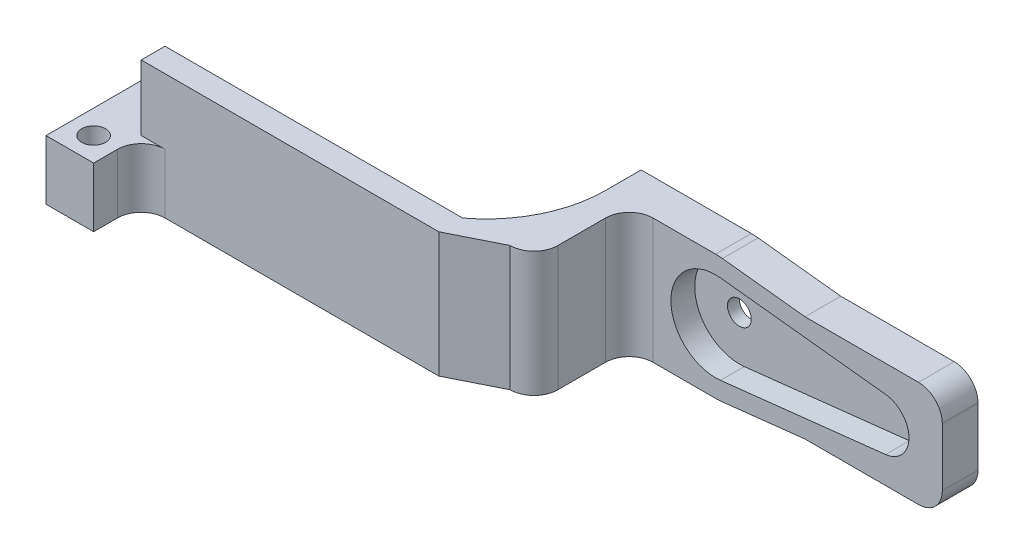
from build123d import *

# Parameters (mm, degrees)
BOSS_EXTRUDE1_DEPTH      = 2
BOSS_EXTRUDE2_DEPTH      = 1
SKETCH3_R                = 1
CUT_EXTRUDE1_DEPTH       = 1
BOSS_EXTRUDE3_DEPTH      = 2
BOSS_EXTRUDE3_DEPTH_BACK = 1
BOSS_EXTRUDE4_START      = -3
BOSS_EXTRUDE4_OUTLINE_R  = 1
BOSS_EXTRUDE4_DEPTH      = 3
SKETCH6_R                = 3.500627768
BOSS_EXTRUDE5_DEPTH      = 3
BOSS_EXTRUDE6_DEPTH      = 3
CUT_EXTRUDE2_DEPTH       = 15
FILLET1_R                = 20
FILLET2_R                = 3
FILLET3_R                = 3
SKETCH9_R                = 1
CUT_EXTRUDE3_DEPTH       = 15
CUT_EXTRUDE4_DEPTH       = 1.5
FILLET4_R                = 8
FILLET5_R                = 2
SKETCH11_W               = 110.258684369
SKETCH11_H               = 6.064888907
CUT_EXTRUDE5_DEPTH       = 38
SKETCH12_R               = 18.613151801
CUT_EXTRUDE6_DEPTH       = 29
SKETCH13_W               = 77.706478895
SKETCH13_H               = 41.021519778
CUT_EXTRUDE7_DEPTH       = 1
FILLET6_START            = -4.447684996
FILLET6_DEPTH            = 2
FILLET6_START_2          = 2.447684996
FILLET6_2_DEPTH          = 2
FILLET6_START_3          = -1
FILLET6_3_DEPTH          = 1
FILLET6_START_4          = -2.447684996
FILLET6_4_DEPTH          = 4.895369992
CUT_EXTRUDE8_DEPTH       = 37
CUT_EXTRUDE8_DEPTH_BACK  = 10
SKETCH14_W               = 81.474605317
SKETCH14_H               = 77.503756956
BOSS_EXTRUDE7_DEPTH      = 2
BOSS_EXTRUDE7_DEPTH_BACK = 1
BOSS_EXTRUDE8_DEPTH      = 8
BOSS_EXTRUDE8_DEPTH_BACK = 3
SKETCH16_W               = 2
SKETCH16_H               = 10.5
BOSS_EXTRUDE9_DEPTH      = 10.5
FILLET7_R                = 10
SKETCH18_W               = 1.521986252
SKETCH18_H               = 3
BOSS_EXTRUDE10_DEPTH     = 10.5
FILLET8_R                = 2
SKETCH19_W               = 25
SKETCH19_H               = 2
BOSS_EXTRUDE11_DEPTH     = 10.5
SKETCH20_W               = 4
SKETCH20_H               = 10
SKETCH20_R               = 1
BOSS_EXTRUDE12_DEPTH     = 5
FILLET9_R                = 2
FILLET10_R               = 2
FILLET11_R               = 2


with BuildPart() as part:
    # Sketch1 → Boss-Extrude1 (new body)
    with BuildSketch(Plane.XY):
        with BuildLine():
            Line((14.458185053, 3.677415528), (0.579181495, 5.217954465))
            ThreePointArc((0.579181495, 5.217954465), (-5.25, 0), (0.579181495, -5.217954465))
            Line((0.579181495, -5.217954465), (14.458185053, -3.677415528))
            ThreePointArc((14.458185053, -3.677415528), (17.75, 0), (14.458185053, 3.677415528))
        make_face()
        with BuildLine():
            Line((14.292704626, 2.186571395), (0.413701068, 3.727110332))
            ThreePointArc((0.413701068, 3.727110332), (-3.75, 0), (0.413701068, -3.727110332))
            Line((0.413701068, -3.727110332), (14.292704626, -2.186571395))
            ThreePointArc((14.292704626, -2.186571395), (16.25, 0), (14.292704626, 2.186571395))
        make_face(mode=Mode.SUBTRACT)
    extrude(amount=BOSS_EXTRUDE1_DEPTH)

    # Sketch2 → Boss-Extrude2 (add)
    with BuildSketch(Plane.XY.offset(2)):
        with BuildLine():
            Line((14.458185053, 3.677415528), (0.579181495, 5.217954465))
            ThreePointArc((0.579181495, 5.217954465), (-5.25, 0), (0.579181495, -5.217954465))
            Line((0.579181495, -5.217954465), (14.458185053, -3.677415528))
            ThreePointArc((14.458185053, -3.677415528), (17.75, 0), (14.458185053, 3.677415528))
        make_face()
    extrude(amount=BOSS_EXTRUDE2_DEPTH)

    # Sketch3 → Cut-Extrude1 (cut)
    with BuildSketch(Plane.XY.offset(3)):
        Circle(SKETCH3_R)
    extrude(amount=-CUT_EXTRUDE1_DEPTH, mode=Mode.SUBTRACT)

    # Sketch4 → Boss-Extrude3 (add, two sides: drawn at the far end of the back side and taken through both)
    with BuildSketch(Plane(origin=(0, 0, 2), x_dir=(-1, 0, 0), z_dir=(0, 0, -1)).offset(-BOSS_EXTRUDE3_DEPTH_BACK)):
        with BuildLine():
            Line((-15.26072202, 2.426182253), (-7.518683274, 4.447684996))
            Line((-7.518683274, 4.447684996), (-42.518683274, 4.447684996))
            ThreePointArc((-42.518683274, 4.447684996), (-39.373695053, 3.144988221), (-38.070998278, 0))
            ThreePointArc((-38.070998278, 0), (-39.373695053, -3.144988221), (-42.518683274, -4.447684996))
            Line((-42.518683274, -4.447684996), (-7.518683274, -4.447684996))
            Line((-7.518683274, -4.447684996), (-13.862339481, -2.595687971))
            Line((-13.862339481, -2.595687971), (-16.213670101, -1.84565397))
            Line((-16.213670101, -1.84565397), (-17.166618181, 0))
            Line((-17.166618181, 0), (-15.26072202, 2.426182253))
        make_face()
        with BuildLine():
            ThreePointArc((-38.070998278, 0), (-39.373695053, 3.144988221), (-42.518683274, 4.447684996))
            Line((-42.518683274, 4.447684996), (-42.518683274, 2))
            ThreePointArc((-42.518683274, 2), (-41.104469712, 1.414213562), (-40.518683274, 0))
            ThreePointArc((-40.518683274, 0), (-41.104469712, -1.414213562), (-42.518683274, -2))
            Line((-42.518683274, -2), (-42.518683274, -4.447684996))
            ThreePointArc((-42.518683274, -4.447684996), (-39.373695053, -3.144988221), (-38.070998278, 0))
        make_face()
        with BuildLine():
            Line((-42.518683274, 2), (-42.518683274, 4.447684996))
            ThreePointArc((-42.518683274, 4.447684996), (-46.96636827, 0), (-42.518683274, -4.447684996))
            Line((-42.518683274, -4.447684996), (-42.518683274, -2))
            ThreePointArc((-42.518683274, -2), (-44.518683274, 0), (-42.518683274, 2))
        make_face()
    extrude(amount=BOSS_EXTRUDE3_DEPTH + BOSS_EXTRUDE3_DEPTH_BACK)

    # Boss-Extrude4: read off the stored shape, not the designer's step
    # Boss-Extrude4 outline → Boss-Extrude4 (add)
    with BuildSketch(Plane(origin=(0, 0, 0), x_dir=(-1, 0, 0), z_dir=(0, 0, -1)).offset(BOSS_EXTRUDE4_START)):
        with BuildLine():
            ThreePointArc((-42.518683274, -4.447684996), (-46.96636827, 0), (-42.518683274, 4.447684996))
            Line((-42.518683274, 4.447684996), (-54.290526798, 4.447684996))
            ThreePointArc((-54.290526798, 4.447684996), (-59.289068337, 5.305033813), (-63.716210719, 7.779073998))
            ThreePointArc((-63.716210719, 7.779073998), (-80, 0), (-63.716210719, -7.779073998))
            ThreePointArc((-63.716210719, -7.779073998), (-59.289068337, -5.305033813), (-54.290526798, -4.447684996))
            Line((-54.290526798, -4.447684996), (-42.518683274, -4.447684996))
        make_face()
        with Locations((-68.205771366, -4.5)):
            Circle(BOSS_EXTRUDE4_OUTLINE_R, mode=Mode.SUBTRACT)
        with Locations((-76, 0)):
            Circle(BOSS_EXTRUDE4_OUTLINE_R, mode=Mode.SUBTRACT)
        with Locations((-68.205771366, 4.5)):
            Circle(BOSS_EXTRUDE4_OUTLINE_R, mode=Mode.SUBTRACT)
    extrude(amount=BOSS_EXTRUDE4_DEPTH)

    # Sketch6 → Boss-Extrude5 (add)
    with BuildSketch(Plane(origin=(0, 0, 0), x_dir=(-1, 0, 0), z_dir=(0, 0, -1))):
        with Locations((-42.518683274, 0)):
            Circle(SKETCH6_R)
    extrude(amount=-BOSS_EXTRUDE5_DEPTH)

    # Sketch7 → Boss-Extrude6 (add)
    with BuildSketch(Plane(origin=(0, 0, 0), x_dir=(-1, 0, 0), z_dir=(0, 0, -1))):
        Polygon((-54.290526798, 4.447684996), (-94.290526798, 4.447684996), (-94.290526798, -3.552315004), (-68.73970048, -3.552315004), (-92.931542949, -17.519481766), (-88.931542949, -24.447684996), (-54.290526798, -4.447684996), align=None)
    extrude(amount=-BOSS_EXTRUDE6_DEPTH)

    # Sketch8 → Cut-Extrude2 (cut)
    with BuildSketch(Plane(origin=(0, 0, 0), x_dir=(-1, 0, 0), z_dir=(0, 0, -1))):
        Polygon((-94.290526798, 4.447684996), (-45.837456427, 4.447684996), (-68.326886593, 15.265325323), align=None)
        Polygon((-94.290526798, -3.552315004), (-68.73970048, -3.552315004), (-92.931542949, -17.519481766), align=None)
    extrude(amount=-CUT_EXTRUDE2_DEPTH, mode=Mode.SUBTRACT)

    # Fillet1
    fillet1_edges = [part.edges().sort_by_distance(p)[0] for p in [
        (54.290526798, -4.447684996, 1.5),
    ]]
    fillet(fillet1_edges, radius=FILLET1_R)

    # Fillet2
    fillet2_edges = [part.edges().sort_by_distance(p)[0] for p in [
        (94.290526798, 4.447684996, 1.5),
        (94.290526798, -3.552315004, 1.5),
        (92.931542949, -17.519481766, 1.5),
        (88.931542949, -24.447684996, 1.5),
    ]]
    fillet(fillet2_edges, radius=FILLET2_R)

    # Fillet3
    fillet3_edges = [part.edges().sort_by_distance(p)[0] for p in [
        (68.73970048, -3.552315004, 1.5),
    ]]
    fillet(fillet3_edges, radius=FILLET3_R)

    # Sketch9 → Cut-Extrude3 (cut)
    with BuildSketch(Plane(origin=(0, 0, 0), x_dir=(-1, 0, 0), z_dir=(0, 0, -1))):
        with Locations((-89.290526798, 0.447684996)):
            Circle(SKETCH9_R)
        with Locations((-79.290526798, 0.447684996)):
            Circle(SKETCH9_R)
        with Locations((-77.941161892, -13.483583381)):
            Circle(SKETCH9_R)
        with Locations((-86.60141593, -18.483583381)):
            Circle(SKETCH9_R)
    extrude(amount=-CUT_EXTRUDE3_DEPTH, mode=Mode.SUBTRACT)

    # Sketch10 → Cut-Extrude4 (cut)
    with BuildSketch(Plane(origin=(0, 0, 0), x_dir=(-1, 0, 0), z_dir=(0, 0, -1))):
        with BuildLine():
            Line((-19.05, 2.447684996), (-67.154630008, 2.447684996))
            ThreePointArc((-67.154630008, 2.447684996), (-70.616179326, -5.909234314), (-62.259260015, -2.447684996))
            Line((-62.259260015, -2.447684996), (-19.05, -2.447684996))
            Line((-19.05, -2.447684996), (-19.05, 2.447684996))
        make_face()
    extrude(amount=-CUT_EXTRUDE4_DEPTH, mode=Mode.SUBTRACT)

    # Fillet4
    fillet4_edges = [part.edges().sort_by_distance(p)[0] for p in [
        (62.259260015, -2.447684996, 0.75),
    ]]
    fillet(fillet4_edges, radius=FILLET4_R)

    # Fillet5
    fillet5_edges = [part.edges().sort_by_distance(p)[0] for p in [
        (19.05, 2.447684996, 0.75),
        (19.05, -2.447684996, 0.75),
    ]]
    fillet(fillet5_edges, radius=FILLET5_R)

    # Mirror1: part across plane


with BuildPart() as part_1:
    add(part.part)
    add(part.part.mirror(Plane(origin=(14.05, 0, 0), x_dir=(1, 0, 0), z_dir=(0, 0, 1))))

    # Sketch11 → Cut-Extrude5 (cut)
    with BuildSketch(Plane(origin=(0, 4.447684996, 0), x_dir=(1, 0, 0), z_dir=(0, 1, 0))):
        with Locations((47.771534573, -3.032444454)):
            Rectangle(SKETCH11_W, SKETCH11_H)
    extrude(amount=-CUT_EXTRUDE5_DEPTH, mode=Mode.SUBTRACT)

    # Sketch12 → Cut-Extrude6 (cut)
    with BuildSketch(Plane.XY):
        with Locations((7.534351793, 3.599902348)):
            Circle(SKETCH12_R)
    extrude(amount=CUT_EXTRUDE6_DEPTH, mode=Mode.SUBTRACT)

    # Sketch13 → Cut-Extrude7 (cut)
    with BuildSketch(Plane.XY):
        with Locations((57.903239447, -8.718962854)):
            Rectangle(SKETCH13_W, SKETCH13_H)
    extrude(amount=-CUT_EXTRUDE7_DEPTH, mode=Mode.SUBTRACT)

    # Fillet6: read off the stored shape, not the designer's step
    # Fillet6 outline → Fillet6 (add)
    with BuildSketch(Plane(origin=(0, 0, 0), x_dir=(1, 0, 0), z_dir=(0, 1, 0)).offset(FILLET6_START)):
        with BuildLine():
            Line((19.05, 1), (19.049997006, -1.45e-06))
            ThreePointArc((19.049997006, -1.45e-06), (21.172829345, 0.746793973), (23.408898944, 1))
            Line((23.408898944, 1), (19.05, 1))
        make_face()
    extrude(amount=FILLET6_DEPTH)

    # Fillet6 2 outline → Fillet6 2 (add)
    with BuildSketch(Plane(origin=(0, 0, 0), x_dir=(1, 0, 0), z_dir=(0, 1, 0)).offset(FILLET6_START_2)):
        with BuildLine():
            Line((19.05, 1), (19.049997006, -1.45e-06))
            ThreePointArc((19.049997006, -1.45e-06), (21.172829345, 0.746793973), (23.408898944, 1))
            Line((23.408898944, 1), (19.05, 1))
        make_face()
    extrude(amount=FILLET6_2_DEPTH)

    # Fillet6 3 outline → Fillet6 3 (add)
    with BuildSketch(Plane.XY.offset(FILLET6_START_3)):
        with BuildLine():
            Line((19.05, 2.447684996), (19.05, 0.447684996))
            ThreePointArc((19.05, 0.447684996), (19.635786438, 1.861898559), (21.05, 2.447684996))
            Line((21.05, 2.447684996), (19.05, 2.447684996))
        make_face()
        with BuildLine():
            ThreePointArc((21.05, -2.447684996), (19.635786438, -1.861898559), (19.05, -0.447684996))
            Line((19.05, -0.447684996), (19.05, -2.447684996))
            Line((19.05, -2.447684996), (21.05, -2.447684996))
        make_face()
    extrude(amount=FILLET6_3_DEPTH)

    # Fillet6 4 outline → Fillet6 4 (cut)
    with BuildSketch(Plane(origin=(0, 0, 0), x_dir=(1, 0, 0), z_dir=(0, 1, 0)).offset(FILLET6_START_4)):
        with BuildLine():
            ThreePointArc((23, 0.991636585), (20.973982557, 0.699029961), (19.049997006, -1.45e-06))
            Line((19.049997006, -1.45e-06), (18, -0.508538641))
            Line((18, -0.508538641), (18, -1))
            Line((18, -1), (23, -1))
            Line((23, -1), (23, 0.991636585))
        make_face()
    extrude(amount=FILLET6_4_DEPTH, mode=Mode.SUBTRACT)

    # Sketch14 → Cut-Extrude8 (cut, two sides: drawn at the far end of the back side and taken through both)
    with BuildSketch(Plane.XY.offset(-2).offset(-CUT_EXTRUDE8_DEPTH_BACK)):
        with Locations((59.787302659, 4.447684996)):
            Rectangle(SKETCH14_W, SKETCH14_H)
    extrude(amount=CUT_EXTRUDE8_DEPTH + CUT_EXTRUDE8_DEPTH_BACK, mode=Mode.SUBTRACT)

    # Sketch15 → Boss-Extrude7 (add, two sides: drawn at the far end of the back side and taken through both)
    with BuildSketch(Plane.XY.offset(-2).offset(-BOSS_EXTRUDE7_DEPTH_BACK)):
        Polygon((0, 4.349044766), (-3.638836396, 3.035019198), (-4.3304288, -1.298959868), (-2.356179656, -4.022923876), (0, -4.398909991), (0, -5.25), (-7.25, -5.25), (-7.25, 5.25), (0, 5.25), align=None)
    extrude(amount=BOSS_EXTRUDE7_DEPTH + BOSS_EXTRUDE7_DEPTH_BACK)



with BuildPart() as body_2:
    # Sketch16 → Boss-Extrude8 (new, two sides: drawn at the far end of the back side and taken through both)
    with BuildSketch(Plane.XY.offset(-BOSS_EXTRUDE8_DEPTH_BACK)):
        with Locations((-8.25, 0)):
            Rectangle(SKETCH16_W, SKETCH16_H)
    extrude(amount=BOSS_EXTRUDE8_DEPTH + BOSS_EXTRUDE8_DEPTH_BACK)

    # Sketch17 → Boss-Extrude9 (add)
    with BuildSketch(Plane.XZ.offset(5.25)):
        Polygon((-9.25, 8), (-13.25, 10), (-13.25, 8), (-9.25, 6), align=None)
    extrude(amount=-BOSS_EXTRUDE9_DEPTH)

    # Fillet7
    # the kernel refuses this fillet: 10 mm, written as the material it adds along each edge
    with BuildSketch(Plane(origin=(-9.25, -5.25, 6), x_dir=(0, 0, -1), z_dir=(0, 1, 0))) as fillet7_piece_1:
        with BuildLine():
            CenterArc((6, 10), FILLET7_R, 216.869897646, 53.130102354)
            Line((-2, 4), (-2.16, 3.88))
            ThreePointArc((-2.16, 3.88), (-1.178885438, 1.910557281), (-0.178885438, -0.089442719))
            Line((-0.178885438, -0.089442719), (0, -0.2))
            Line((0, -0.2), (6, -0.2))
            Line((6, -0.2), (6, 0))
        make_face()
    extrude(amount=10.5)


with BuildPart() as part_2:
    add(part_1.part)

    add(body_2.part)  # Boss-Extrude10 merges body 2
    # Sketch18 → Boss-Extrude10 (add)
    with BuildSketch(Plane.XZ.offset(5.25)):
        with Locations((-7.358034117, -1.5)):
            Rectangle(SKETCH18_W, SKETCH18_H)
    extrude(amount=-BOSS_EXTRUDE10_DEPTH)

    # Fillet8
    fillet8_edges = [part_2.edges().sort_by_distance(p)[0] for p in [
        (-7.25, 0, 0),
    ]]
    fillet(fillet8_edges, radius=FILLET8_R)

    # Sketch19 → Boss-Extrude11 (add)
    with BuildSketch(Plane.XZ.offset(5.25)):
        with Locations((-25.75, 9)):
            Rectangle(SKETCH19_W, SKETCH19_H)
    extrude(amount=-BOSS_EXTRUDE11_DEPTH)

    # Sketch20 → Boss-Extrude12 (add)
    with BuildSketch(Plane.XZ.offset(5.25)):
        with Locations((-40.25, 9)):
            Rectangle(SKETCH20_W, SKETCH20_H)
        with Locations(Location((-40.25, 6, 0), (0, 0, 270))):
            Circle(SKETCH20_R, mode=Mode.SUBTRACT)
        with Locations(Location((-40.25, 12, 0), (0, 0, 270))):
            Circle(SKETCH20_R, mode=Mode.SUBTRACT)
    extrude(amount=-BOSS_EXTRUDE12_DEPTH)

    # Fillet9
    fillet9_edges = [part_2.edges().sort_by_distance(p)[0] for p in [
        (-38.25, -2.75, 10),
        (-38.25, -2.75, 8),
    ]]
    fillet(fillet9_edges, radius=FILLET9_R)

    # Fillet10
    fillet10_edges = [part_2.edges().sort_by_distance(p)[0] for p in [
        (-7.25, 0, 8),
    ]]
    fillet(fillet10_edges, radius=FILLET10_R - 0.0001)  # a hair under: the kernel refuses the full size

    # Fillet11
    fillet11_edges = [part_2.edges().sort_by_distance(p)[0] for p in [
        (19.05, 4.447684996, -1.5),
        (19.05, -4.447684996, -1.5),
    ]]
    fillet(fillet11_edges, radius=FILLET11_R - 0.0001)  # a hair under: the kernel refuses the full size


solid = part_2.part
